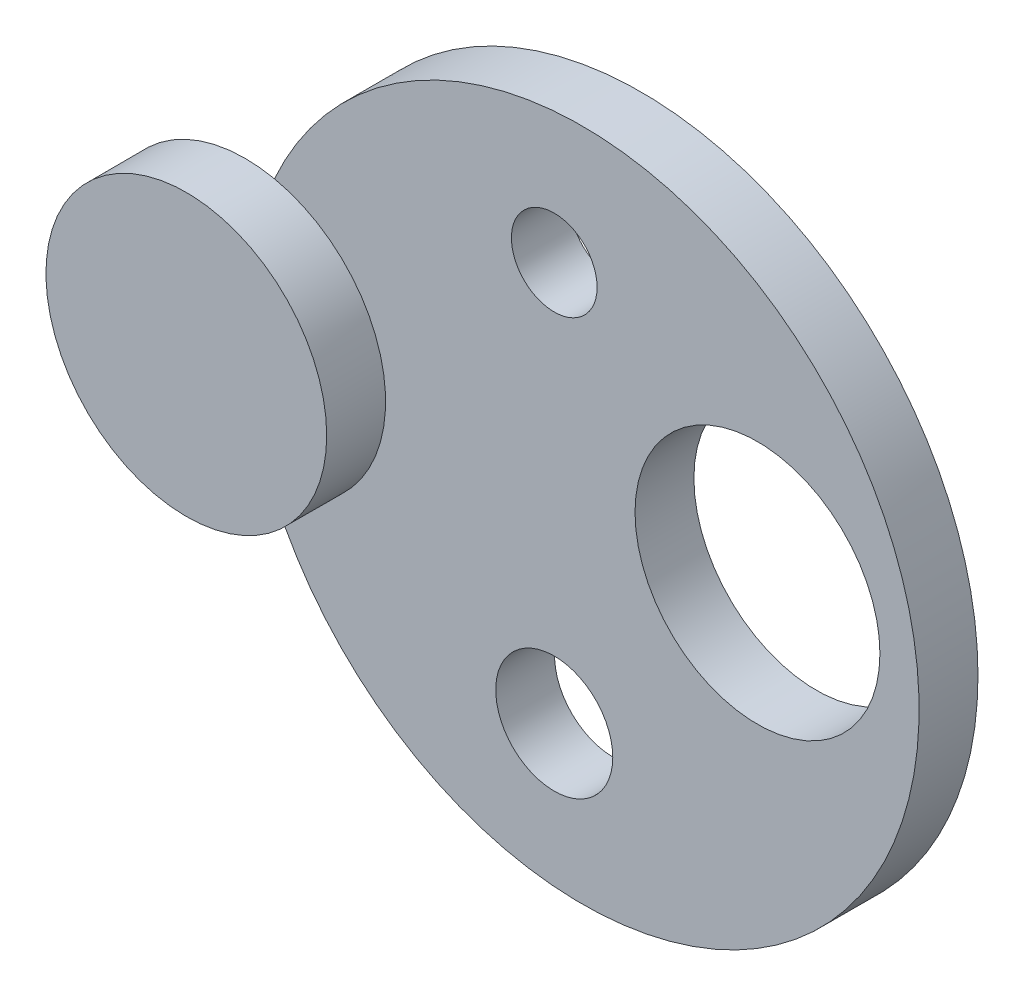
from build123d import *

# Parameters (mm, degrees)
CROQUIS1_R              = 57.226702921
CROQUIS1_R_2            = 7.277968804
CROQUIS1_R_3            = 9.940183118
CROQUIS1_R_4            = 20.796607535
SALIENTE_EXTRUIR1_DEPTH = 10
CROQUIS2_R              = 23.842859528
SALIENTE_EXTRUIR2_DEPTH = 10


with BuildPart() as part:
    # Croquis1 → Saliente-Extruir1 (new body)
    with BuildSketch(Plane.XY):
        Circle(CROQUIS1_R)
        with Locations((-4.741989664, 34.759410431)):
            Circle(CROQUIS1_R_2, mode=Mode.SUBTRACT)
        with Locations((-4.741989664, -33.045918367)):
            Circle(CROQUIS1_R_3, mode=Mode.SUBTRACT)
        with Locations((29.772636186, 4.89569161)):
            Circle(CROQUIS1_R_4, mode=Mode.SUBTRACT)
    extrude(amount=SALIENTE_EXTRUIR1_DEPTH)

    # Croquis2 → Saliente-Extruir2 (add)
    with BuildSketch(Plane.XY.offset(10)):
        with Locations((-57.226702921, 0)):
            Circle(CROQUIS2_R)
    extrude(amount=SALIENTE_EXTRUIR2_DEPTH)


solid = part.part
